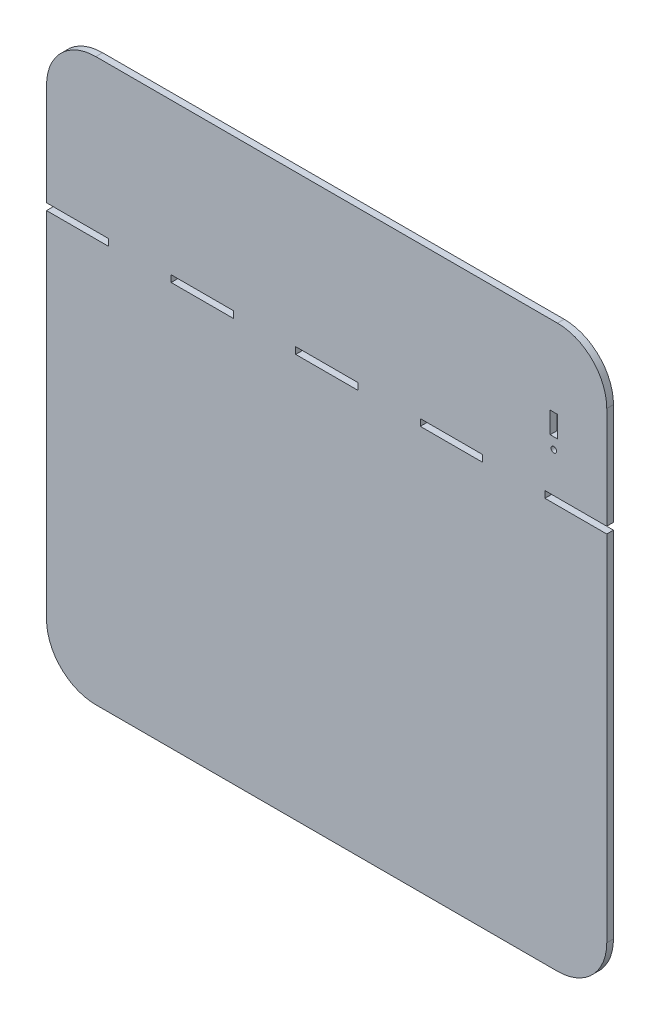
from build123d import *

# Parameters (mm, degrees)
SKETCH1_W           = 500
SKETCH1_H           = 501
BOSS_EXTRUDE1_DEPTH = 6
FILLET1_R           = 44
SKETCH2_W           = 55.5
SKETCH2_H           = 6
CUT_EXTRUDE1_DEPTH  = 10
LPATTERN1_COUNT     = 5
LPATTERN1_PITCH     = 111.2
SKETCH4_W           = 6.5
SKETCH4_H           = 19
CUT_EXTRUDE3_DEPTH  = 10
SKETCH3_R           = 2.5
CUT_EXTRUDE2_DEPTH  = 10


with BuildPart() as part:
    # Sketch1 → Boss-Extrude1 (new body)
    with BuildSketch(Plane.XY):
        with Locations((250, 250.5)):
            Rectangle(SKETCH1_W, SKETCH1_H)
    extrude(amount=BOSS_EXTRUDE1_DEPTH)

    # Fillet1
    fillet1_edges = [part.edges().sort_by_distance(p)[0] for p in [
        (0, 0, 3),
        (0, 501, 3),
        (500, 0, 3),
        (500, 501, 3),
    ]]
    fillet(fillet1_edges, radius=FILLET1_R)

    # Sketch2 → Cut-Extrude1 (cut)
    with BuildSketch(Plane(origin=(0, 0, 0), x_dir=(-1, 0, 0), z_dir=(0, 0, -1))):
        with Locations((-27.75, 363)):
            Rectangle(SKETCH2_W, SKETCH2_H)
    cut_extrude1 = extrude(amount=-CUT_EXTRUDE1_DEPTH, mode=Mode.SUBTRACT)

    # LPattern1: Cut-Extrude1 ×5
    with Locations(*[(i * LPATTERN1_PITCH, 0, 0) for i in range(1, LPATTERN1_COUNT)]):
        add(cut_extrude1, mode=Mode.SUBTRACT)

    # Sketch4 → Cut-Extrude3 (cut)
    with BuildSketch(Plane(origin=(0, 0, 0), x_dir=(-1, 0, 0), z_dir=(0, 0, -1))):
        with Locations((-452.75, 421)):
            Rectangle(SKETCH4_W, SKETCH4_H)
    extrude(amount=-CUT_EXTRUDE3_DEPTH, mode=Mode.SUBTRACT)

    # Sketch3 → Cut-Extrude2 (cut)
    with BuildSketch(Plane(origin=(0, 0, 0), x_dir=(-1, 0, 0), z_dir=(0, 0, -1))):
        with Locations((-452.75, 401.5)):
            Circle(SKETCH3_R)
    extrude(amount=-CUT_EXTRUDE2_DEPTH, mode=Mode.SUBTRACT)


solid = part.part
